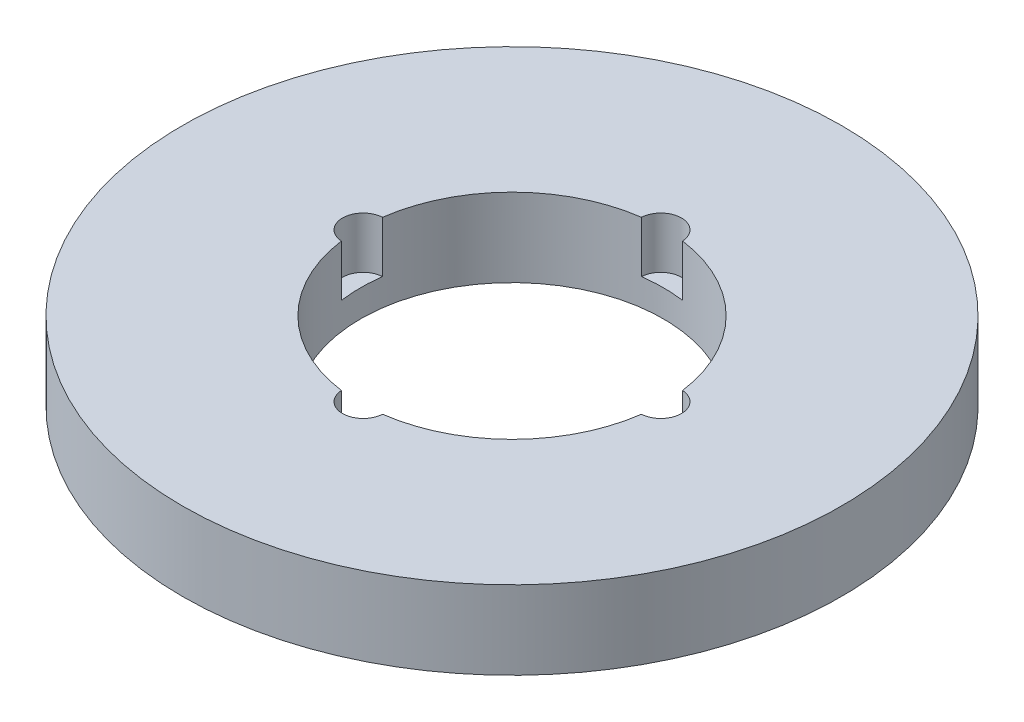
from build123d import *

# Parameters (mm, degrees)
SKETCH1_R           = 92.5
BOSS_EXTRUDE1_DEPTH = 22
SKETCH2_R           = 42.5
CUT_EXTRUDE1_DEPTH  = 133.651799837
SKETCH3_R           = 5.787428748
CUT_EXTRUDE2_DEPTH  = 14.423861054
CIRPATTERN1_COUNT   = 4


with BuildPart() as part:
    # Sketch1 → Boss-Extrude1 (new body)
    with BuildSketch(Plane(origin=(0, 0, 0), x_dir=(1, 0, 0), z_dir=(0, 1, 0))):
        Circle(SKETCH1_R)
    extrude(amount=BOSS_EXTRUDE1_DEPTH)

    # Sketch2 → Cut-Extrude1 (cut, through all)
    with BuildSketch(Plane(origin=(0, 0, 0), x_dir=(1, 0, 0), z_dir=(0, 1, 0))):
        Circle(SKETCH2_R)
    extrude(amount=CUT_EXTRUDE1_DEPTH, mode=Mode.SUBTRACT)

    # Sketch3 → Cut-Extrude2 (cut)
    with BuildSketch(Plane(origin=(0, 22, 0), x_dir=(1, 0, 0), z_dir=(0, 1, 0))):
        with Locations((-41.769182824, 0)):
            Circle(SKETCH3_R)
    cut_extrude2 = extrude(amount=-CUT_EXTRUDE2_DEPTH, mode=Mode.SUBTRACT)

    # CirPattern1: Cut-Extrude2 ×4 about axis
    cirpattern1_axis = Axis((0, 0, 0), (0, 1, 0))
    for i in range(1, CIRPATTERN1_COUNT):
        add(cut_extrude2.rotate(cirpattern1_axis, i * 360 / CIRPATTERN1_COUNT), mode=Mode.SUBTRACT)


solid = part.part
